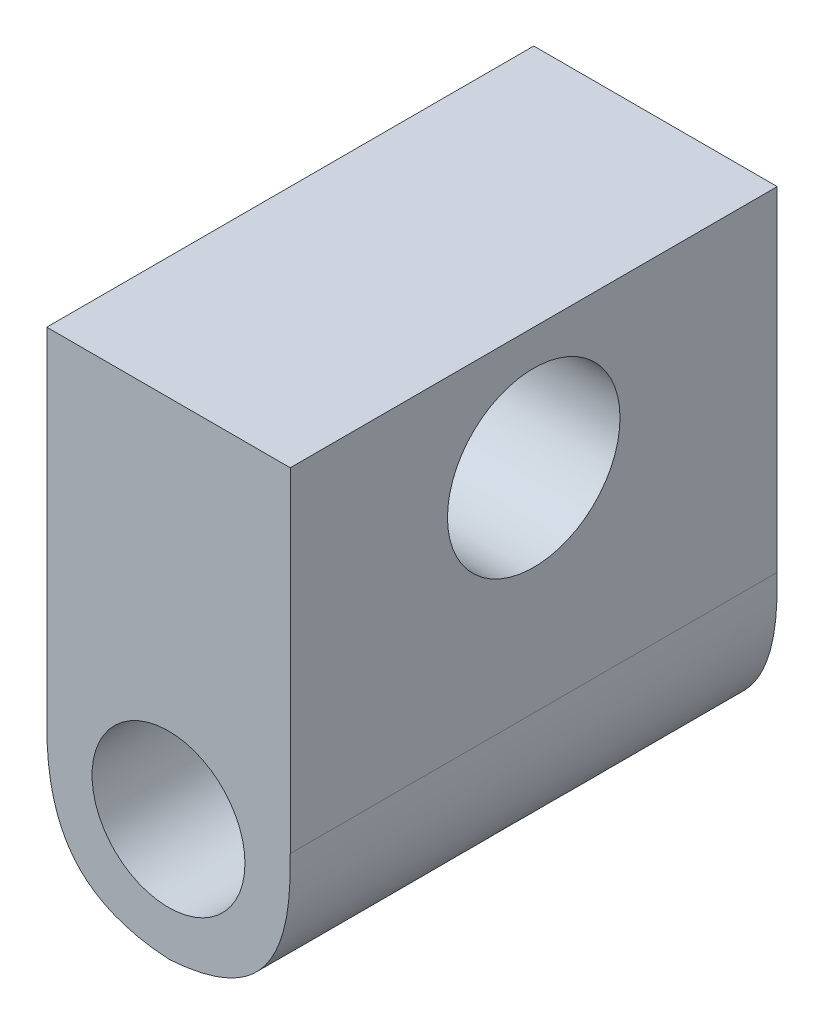
from build123d import *

# Parameters (mm, degrees)
SKETCH1_W           = 12.7
SKETCH1_H           = 12.7
SKETCH1_R           = 3.9878
BOSS_EXTRUDE1_DEPTH = 25.4
SKETCH2_R           = 4.49961
CUT_EXTRUDE1_DEPTH  = 12.7
FILLET1_SIZE        = 7.9756


with BuildPart() as part:
    # Sketch1 → Boss-Extrude1 (new body)
    # profile 1 of 2: a face of its own
    with BuildSketch(Plane.XY):
        with Locations((0, 12.7)):
            Rectangle(SKETCH1_W, SKETCH1_H)
    # profile 2 of 2: a face of its own
    with BuildSketch(Plane.XY):
        Rectangle(SKETCH1_W, SKETCH1_H)
        Circle(SKETCH1_R, mode=Mode.SUBTRACT)
    extrude(amount=-BOSS_EXTRUDE1_DEPTH)

    # Sketch2 → Cut-Extrude1 (cut)
    with BuildSketch(Plane.ZY.offset(6.35)):
        with Locations((-12.7, 12.7)):
            Circle(SKETCH2_R)
    extrude(amount=-CUT_EXTRUDE1_DEPTH, mode=Mode.SUBTRACT)

    # Fillet1
    # a fillet whose section is not a circle: 7.9756 mm, written as the material it takes off along each edge
    with BuildSketch(Plane(origin=(-6.35, -6.35, 19.939), x_dir=(1, 0, 0), z_dir=(0, 0, -1)), Plane(origin=(6.35, -6.35, 19.939), x_dir=(0, 1, 0), z_dir=(0, 0, -1))) as fillet1_piece_1:
        with BuildLine():
            add(Edge.make_bspline([(FILLET1_SIZE, 0), (FILLET1_SIZE * 0.831801948466, 0), (FILLET1_SIZE * 0.663603896932, 0), (FILLET1_SIZE * 0.292893218813, -FILLET1_SIZE * 0.0716919198361), (FILLET1_SIZE * 0.0716919198361, -FILLET1_SIZE * 0.292893218813), (0, -FILLET1_SIZE * 0.663603896932), (0, -FILLET1_SIZE * 0.831801948466), (0, -FILLET1_SIZE)], knots=[0, 0, 0, 0, 0, 0, 0.5, 0.5, 1, 1, 1, 1, 1, 1], degree=5))
            Line((0, -FILLET1_SIZE), (0, 0))
            Line((0, 0), (FILLET1_SIZE, 0))
        make_face()
    extrude(amount=65.278, mode=Mode.SUBTRACT)


solid = part.part
